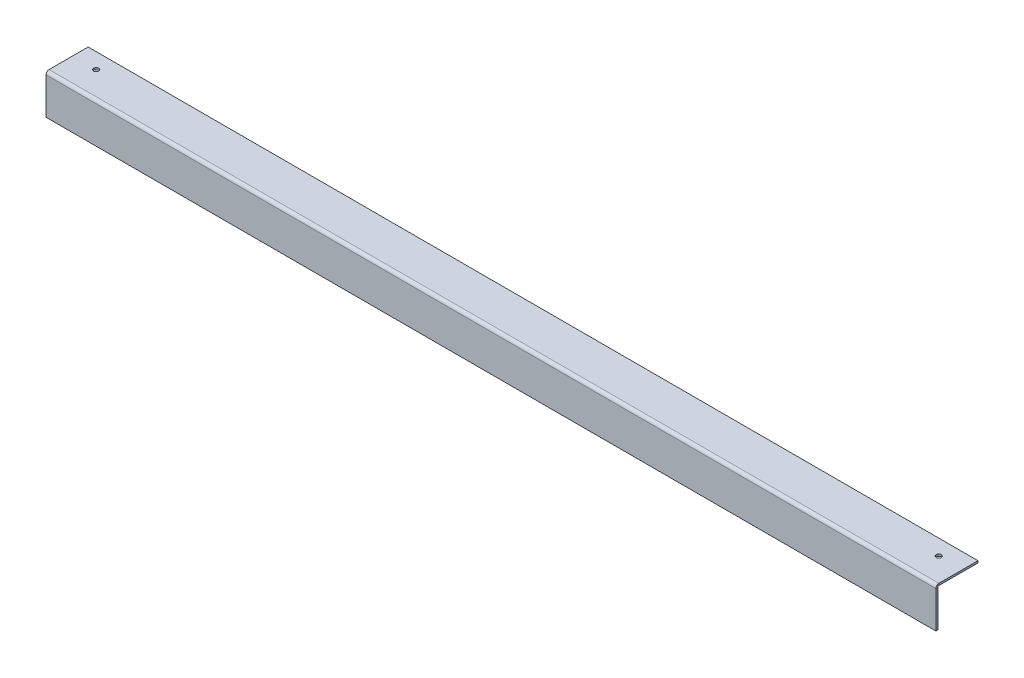
from build123d import *

# Parameters (mm, degrees)
SKETCH1_W                    = 1193.8
SKETCH1_H                    = 53.975
BASE_FLANGE1_DEPTH           = 2.58826
EDGE_FLANGE1_STRIP_W         = 13.40104
EDGE_FLANGE1_STRIP_H         = 2.58826
EDGE_FLANGE1_STRIP_CUT_DEPTH = 1193.8
EDGE_FLANGE1_DEPTH           = 1193.8
F_1_4_CLEARANCE_HOLE1_D      = 6.7564


# Sheet-metal steps are written as plain solids
with BuildPart() as part:
    # Sketch1 → Base-Flange1 (new body)
    with BuildSketch(Plane(origin=(0, 0, 0), x_dir=(1, 0, 0), z_dir=(0, 1, 0))):
        Rectangle(SKETCH1_W, SKETCH1_H)
    extrude(amount=-BASE_FLANGE1_DEPTH)

    # Edge-Flange1 strip (across the edge) → Edge-Flange1 strip cut (cut)
    with BuildSketch(Plane(origin=(596.9, -2.58826, 26.9875), x_dir=(0, 0, -1), z_dir=(-1, 0, 0))):
        with Locations((-5.17652, -1.29413)):
            Rectangle(EDGE_FLANGE1_STRIP_W, EDGE_FLANGE1_STRIP_H)
    extrude(amount=EDGE_FLANGE1_STRIP_CUT_DEPTH, mode=Mode.SUBTRACT)

    # Edge-Flange1 section (across the edge) → Edge-Flange1 (add)
    with BuildSketch(Plane(origin=(596.9, -2.58826, 26.9875), x_dir=(0, 0, -1), z_dir=(-1, 0, 0))):
        with BuildLine():
            Line((-2.58826, 1.524), (-2.58826, 50.8))
            Line((-2.58826, 50.8), (0, 50.8))
            Line((0, 50.8), (0, 1.524))
            ThreePointArc((0, 1.524), (0.446369265, 0.446369265), (1.524, 0))
            Line((1.524, 0), (1.524, -2.58826))
            ThreePointArc((1.524, -2.58826), (-1.383806932, -1.383806932), (-2.58826, 1.524))
        make_face()
    extrude(amount=EDGE_FLANGE1_DEPTH)

    # 1/4 Clearance Hole1 (through all)
    with Locations(Plane(origin=(0, 0, 0), x_dir=(1, 0, 0), z_dir=(0, 1, 0))):
        with Locations((565.15, 6.0325), (-565.15, 6.0325)):
            Hole(F_1_4_CLEARANCE_HOLE1_D / 2)


solid = part.part
